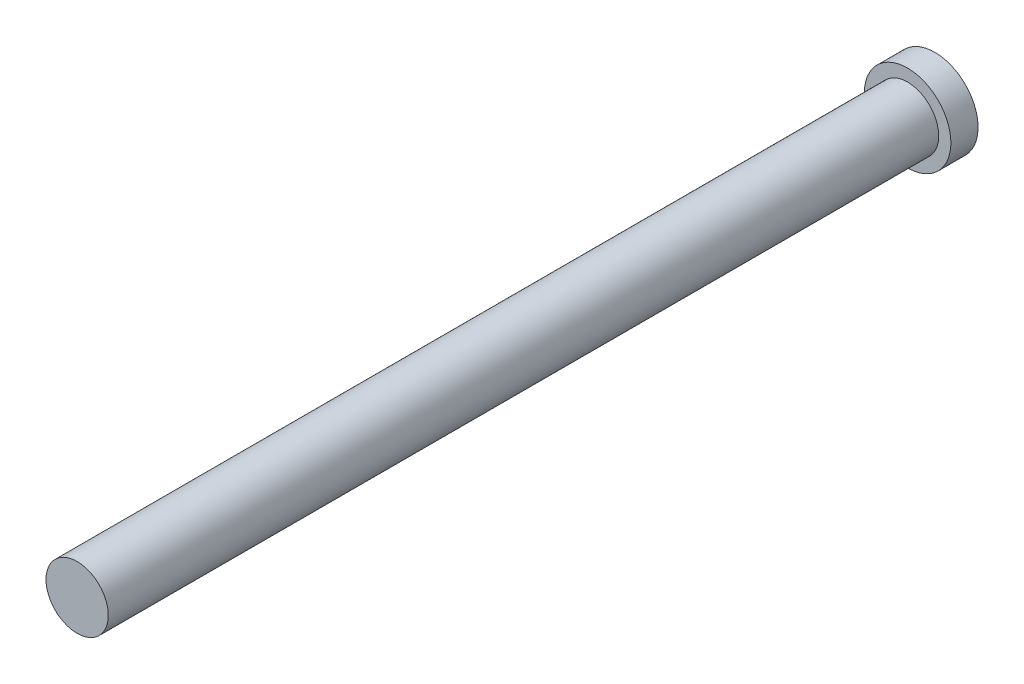
from build123d import *

# Parameters (mm, degrees)
SKETCH1_R           = 1.143
BOSS_EXTRUDE1_DEPTH = 30.48
SKETCH2_R           = 1.5875
BOSS_EXTRUDE2_DEPTH = 1


with BuildPart() as part:
    # Sketch1 → Boss-Extrude1 (new body)
    with BuildSketch(Plane.XY):
        Circle(SKETCH1_R)
    extrude(amount=BOSS_EXTRUDE1_DEPTH)

    # Sketch2 → Boss-Extrude2 (add)
    with BuildSketch(Plane(origin=(0, 0, 0), x_dir=(-1, 0, 0), z_dir=(0, 0, -1))):
        Circle(SKETCH2_R)
    extrude(amount=BOSS_EXTRUDE2_DEPTH)


solid = part.part
